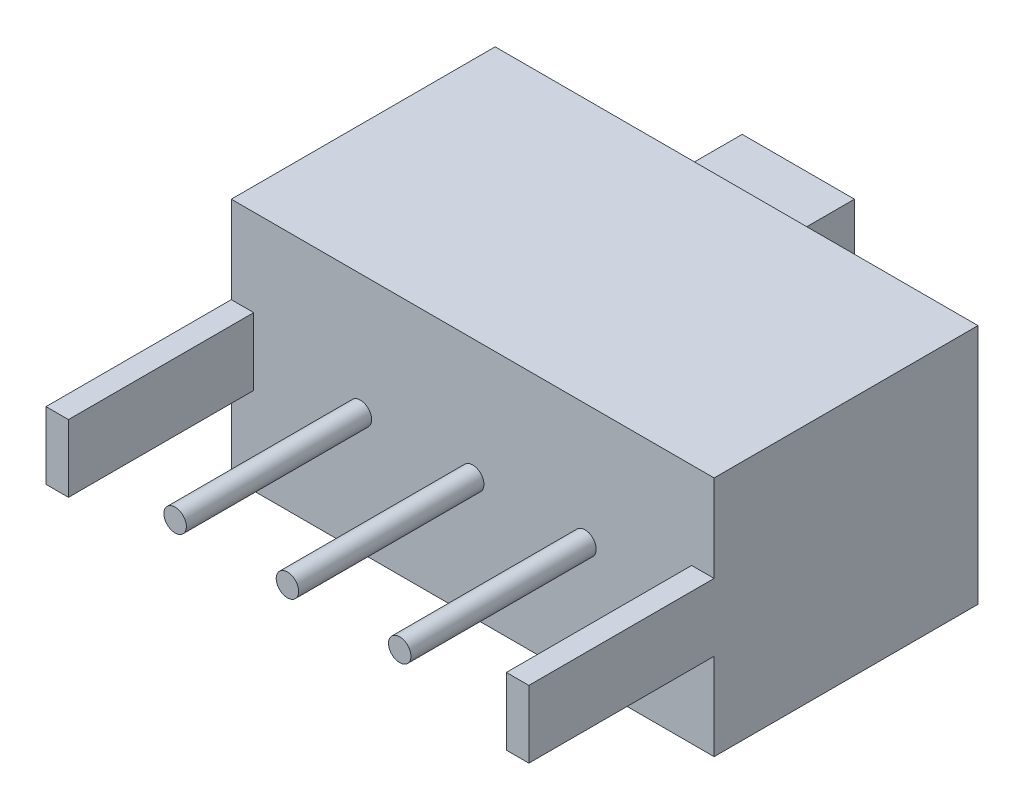
from build123d import *

# Parameters (mm, degrees)
SKETCH_1_W          = 8.6
SKETCH_1_H          = 4.3
EXTRUDE_1_DEPTH     = 4.7
SKETCH_1_3_W        = 4
SKETCH_1_3_H        = 2.2
SKETCH_1_3_W_2      = 2
SKETCH_1_3_H_2      = 2
CUT_EXTRUDE_1_DEPTH = 0.2
SKETCH_1_4_W        = 2
SKETCH_1_4_H        = 2
EXTRUDE_2_DEPTH     = 2
SKETCH_2_R          = 0.2
SKETCH_2_W          = 0.4
SKETCH_2_H          = 1.2
EXTRUDE_3_DEPTH     = 3.3


with BuildPart() as part:
    # 草图1 → 凸台-拉伸1 (new body)
    with BuildSketch(Plane.XY):
        with Locations((4.3, -2.15)):
            Rectangle(SKETCH_1_W, SKETCH_1_H)
    extrude(amount=EXTRUDE_1_DEPTH)

    # 草图1<3> → 切除-拉伸1 (cut)
    with BuildSketch(Plane.XY):
        with Locations((4.3, -2.15)):
            Rectangle(SKETCH_1_3_W, SKETCH_1_3_H)
        with Locations((3.4, -2.15)):
            Rectangle(SKETCH_1_3_W_2, SKETCH_1_3_H_2, mode=Mode.SUBTRACT)
    extrude(amount=CUT_EXTRUDE_1_DEPTH, mode=Mode.SUBTRACT)

    # 草图1<4> → 凸台-拉伸2 (add)
    with BuildSketch(Plane.XY):
        with Locations((3.4, -2.15)):
            Rectangle(SKETCH_1_4_W, SKETCH_1_4_H)
    extrude(amount=-EXTRUDE_2_DEPTH)

    # 草图2 → 凸台-拉伸3 (add)
    with BuildSketch(Plane.XY.offset(4.7)):
        with Locations((2.3, -2.15)):
            Circle(SKETCH_2_R)
        with Locations((4.3, -2.15)):
            Circle(SKETCH_2_R)
        with Locations((6.3, -2.15)):
            Circle(SKETCH_2_R)
        with Locations((8.4, -2.15)):
            Rectangle(SKETCH_2_W, SKETCH_2_H)
        with Locations((0.2, -2.15)):
            Rectangle(SKETCH_2_W, SKETCH_2_H)
    extrude(amount=EXTRUDE_3_DEPTH)


solid = part.part
